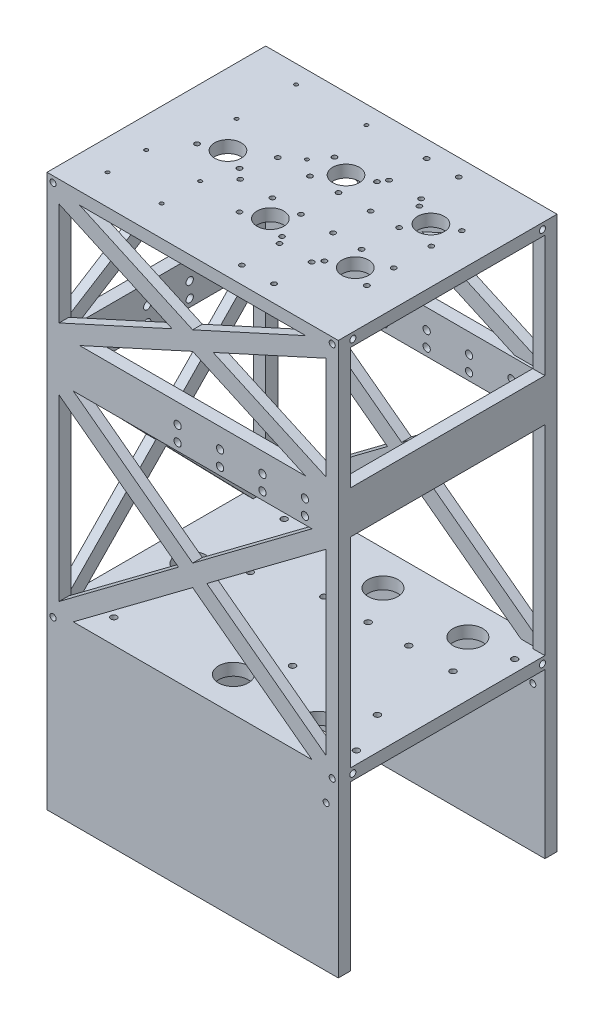
from build123d import *

# Parameters (mm, degrees)
SKETCH1_W                = 240.15
SKETCH1_H                = 180.3
BOSS_EXTRUDE1_DEPTH      = 145
SKETCH2_R                = 12.25
CUT_EXTRUDE1_DEPTH       = 120
SKETCH3_W                = 160.42
SKETCH3_H                = 135.06
CUT_EXTRUDE3_DEPTH       = 220
SKETCH9_W                = 240.15
SKETCH9_H                = 180.3
BOSS_EXTRUDE3_DEPTH      = 310.134
SKETCH14_R               = 11
SKETCH14_R_2             = 2
SKETCH14_R_3             = 1.5
CUT_EXTRUDE6_DEPTH       = 11
SKETCH15_W               = 220.15
SKETCH15_H               = 100.24
SKETCH15_H_2             = 164.844
CUT_EXTRUDE7_DEPTH       = 505.056597597
SKETCH16_W               = 160.3
SKETCH16_H               = 100.24
SKETCH16_H_2             = 164.842
CUT_EXTRUDE8_DEPTH       = 523.442344145
CUT_EXTRUDE9_REACH       = 378.161
SKETCH17_W               = 220.15
SKETCH17_H               = 160.3
SKETCH18_R               = 3
CUT_EXTRUDE10_DEPTH      = 249
SKETCH19_R               = 3
CUT_EXTRUDE11_DEPTH      = 104
SKETCH21_R               = 2.5
CUT_EXTRUDE12_DEPTH      = 8
SKETCH22_R               = 2.5
CUT_EXTRUDE13_DEPTH      = 8
CUT_EXTRUDE14_START      = -8
SKETCH23_R               = 2.5
CUT_EXTRUDE14_DEPTH      = 8
CUT_EXTRUDE15_START      = -8
SKETCH24_R               = 2.5
CUT_EXTRUDE15_DEPTH      = 8
BOSS_EXTRUDE4_DEPTH      = 8
BOSS_EXTRUDE5_DEPTH      = 8
BOSS_EXTRUDE6_DEPTH      = 8
BOSS_EXTRUDE7_DEPTH      = 8
BOSS_EXTRUDE8_DEPTH      = 8
BOSS_EXTRUDE9_DEPTH      = 8
CUT_EXTRUDE16_REACH      = 346.569
SKETCH32_R               = 2.5
CUT_EXTRUDE17_DEPTH      = 501.587148438
CUT_EXTRUDE17_DEPTH_BACK = 501.587148438
SKETCH33_R               = 2.5
CUT_EXTRUDE18_DEPTH      = 514.491947801
CUT_EXTRUDE18_DEPTH_BACK = 514.491947801
SKETCH34_R               = 2.5
SKETCH35_R               = 2.5
CUT_EXTRUDE19_DEPTH      = 10
SKETCH37_R               = 1.5
CUT_EXTRUDE20_DEPTH      = 10


with BuildPart() as part:
    # Sketch1 → Boss-Extrude1 (new body)
    with BuildSketch(Plane(origin=(0, 0, 0), x_dir=(1, 0, 0), z_dir=(0, 1, 0))):
        Rectangle(SKETCH1_W, SKETCH1_H)
    extrude(amount=BOSS_EXTRUDE1_DEPTH)

    # Sketch2 → Cut-Extrude1 (cut)
    with BuildSketch(Plane(origin=(0, 145, 0), x_dir=(1, 0, 0), z_dir=(0, 1, 0))):
        with Locations((75.105, -61.65)):
            Circle(SKETCH2_R)
        with Locations((5.105, -61.65)):
            Circle(SKETCH2_R)
        with Locations((75.105, 61.65)):
            Circle(SKETCH2_R)
        with Locations((5.105, 61.65)):
            Circle(SKETCH2_R)
        with Locations((-91.515, 0)):
            Circle(SKETCH2_R)
    extrude(amount=-CUT_EXTRUDE1_DEPTH, mode=Mode.SUBTRACT)

    # Sketch3 → Cut-Extrude3 (cut)
    with BuildSketch(Plane(origin=(120.075, 0, 0), x_dir=(0, 0, -1), z_dir=(1, 0, 0))):
        with Locations((0, 67.53)):
            Rectangle(SKETCH3_W, SKETCH3_H)
    extrude(amount=-CUT_EXTRUDE3_DEPTH, mode=Mode.SUBTRACT)

    # Sketch9 → Boss-Extrude3 (add)
    with BuildSketch(Plane(origin=(0, 145, 0), x_dir=(1, 0, 0), z_dir=(0, 1, 0))):
        Rectangle(SKETCH9_W, SKETCH9_H)
    extrude(amount=BOSS_EXTRUDE3_DEPTH)

    # Sketch14 → Cut-Extrude6 (cut)
    with BuildSketch(Plane(origin=(0, 455.134, 0), x_dir=(1, 0, 0), z_dir=(0, 1, 0))):
        with Locations((5.105, -31.17)):
            Circle(SKETCH14_R)
        with Locations((75.105, 31.17)):
            Circle(SKETCH14_R)
        with Locations((-61.035, 0)):
            Circle(SKETCH14_R)
        with Locations((75.105, -31.17)):
            Circle(SKETCH14_R)
        with Locations((92.605, -39.14)):
            Circle(SKETCH14_R_2)
        with Locations((57.605, -39.14)):
            Circle(SKETCH14_R_2)
        with Locations((5.105, 31.17)):
            Circle(SKETCH14_R)
        with Locations((92.605, 39.14)):
            Circle(SKETCH14_R_2)
        with Locations((57.605, 39.14)):
            Circle(SKETCH14_R_2)
        with Locations((22.605, -39.14)):
            Circle(SKETCH14_R_2)
        with Locations((-12.395, -39.14)):
            Circle(SKETCH14_R_2)
        with Locations((22.605, 39.14)):
            Circle(SKETCH14_R_2)
        with Locations((-12.395, 39.14)):
            Circle(SKETCH14_R_2)
        with Locations((-43.535, -7.97)):
            Circle(SKETCH14_R_2)
        with Locations((-78.535, -7.97)):
            Circle(SKETCH14_R_2)
        with Locations((-35.422134016, 15.5)):
            Circle(SKETCH14_R_2)
        with Locations((-8.922134016, 15.5)):
            Circle(SKETCH14_R_2)
        with Locations((-8.922134016, -15.5)):
            Circle(SKETCH14_R_2)
        with Locations((-35.422134016, -15.5)):
            Circle(SKETCH14_R_2)
        with Locations((14.577865984, 15.5)):
            Circle(SKETCH14_R_2)
        with Locations((41.077865984, 15.5)):
            Circle(SKETCH14_R_2)
        with Locations((41.077865984, -15.5)):
            Circle(SKETCH14_R_2)
        with Locations((14.577865984, -15.5)):
            Circle(SKETCH14_R_2)
        with Locations((64.577865984, 15.5)):
            Circle(SKETCH14_R_2)
        with Locations((91.077865984, 15.5)):
            Circle(SKETCH14_R_2)
        with Locations((91.077865984, -15.5)):
            Circle(SKETCH14_R_2)
        with Locations((64.577865984, -15.5)):
            Circle(SKETCH14_R_2)
        with Locations((53.075, -45.15)):
            Circle(SKETCH14_R_2)
        with Locations((26.575, -45.15)):
            Circle(SKETCH14_R_2)
        with Locations((26.575, -76.15)):
            Circle(SKETCH14_R_2)
        with Locations((53.075, -76.15)):
            Circle(SKETCH14_R_2)
        with Locations((53.075, 76.15)):
            Circle(SKETCH14_R_2)
        with Locations((26.575, 76.15)):
            Circle(SKETCH14_R_2)
        with Locations((26.575, 45.15)):
            Circle(SKETCH14_R_2)
        with Locations((53.075, 45.15)):
            Circle(SKETCH14_R_2)
        with Locations((-80.075, 75.15)):
            Circle(SKETCH14_R_3)
        with Locations((-22.075, 75.15)):
            Circle(SKETCH14_R_3)
        with Locations((-22.075, 26.15)):
            Circle(SKETCH14_R_3)
        with Locations((-80.075, 26.15)):
            Circle(SKETCH14_R_3)
    extrude(amount=-CUT_EXTRUDE6_DEPTH, mode=Mode.SUBTRACT)

    # Sketch15 → Cut-Extrude7 (cut, through all)
    with BuildSketch(Plane(origin=(0, 0, -90.15), x_dir=(-1, 0, 0), z_dir=(0, 0, -1))):
        with Locations((0, 395.014)):
            Rectangle(SKETCH15_W, SKETCH15_H)
        with Locations((0, 227.422)):
            Rectangle(SKETCH15_W, SKETCH15_H_2)
    extrude(amount=-CUT_EXTRUDE7_DEPTH, mode=Mode.SUBTRACT)

    # Sketch16 → Cut-Extrude8 (cut, through all)
    with BuildSketch(Plane(origin=(120.075, 0, 0), x_dir=(0, 0, -1), z_dir=(1, 0, 0))):
        with Locations((0, 395.014)):
            Rectangle(SKETCH16_W, SKETCH16_H)
        with Locations((0, 227.421)):
            Rectangle(SKETCH16_W, SKETCH16_H_2)
    extrude(amount=-CUT_EXTRUDE8_DEPTH, mode=Mode.SUBTRACT)

    # Sketch17 → Cut-Extrude9 (cut, up to next)
    with BuildSketch(Plane(origin=(0, 344.894, 0), x_dir=(1, 0, 0), z_dir=(0, 1, 0)), mode=Mode.PRIVATE) as cut_extrude9_sk1:
        Rectangle(SKETCH17_W, SKETCH17_H)
    cut_extrude9_tool1 = extrude(cut_extrude9_sk1.sketch, amount=-CUT_EXTRUDE9_REACH, mode=Mode.PRIVATE) & part.part
    add(cut_extrude9_tool1.solids().sort_by_distance((0, 344.894, 0))[0], mode=Mode.SUBTRACT)

    # Sketch18 → Cut-Extrude10 (cut)
    with BuildSketch(Plane.XY.offset(90.15)):
        with Locations((-12.395, 316.144)):
            Circle(SKETCH18_R)
        with Locations((22.605, 316.144)):
            Circle(SKETCH18_R)
        with Locations((57.605, 316.144)):
            Circle(SKETCH18_R)
        with Locations((92.605, 316.144)):
            Circle(SKETCH18_R)
        with Locations((92.605, 328.644)):
            Circle(SKETCH18_R)
        with Locations((57.605, 328.644)):
            Circle(SKETCH18_R)
        with Locations((22.605, 328.644)):
            Circle(SKETCH18_R)
        with Locations((-12.395, 328.644)):
            Circle(SKETCH18_R)
    extrude(amount=-CUT_EXTRUDE10_DEPTH, mode=Mode.SUBTRACT)

    # Sketch19 → Cut-Extrude11 (cut)
    with BuildSketch(Plane.ZY.offset(120.075)):
        with Locations((-17.5, 316.142)):
            Circle(SKETCH19_R)
        with Locations((17.5, 316.142)):
            Circle(SKETCH19_R)
        with Locations((17.5, 328.642)):
            Circle(SKETCH19_R)
        with Locations((-17.5, 328.642)):
            Circle(SKETCH19_R)
    extrude(amount=-CUT_EXTRUDE11_DEPTH, mode=Mode.SUBTRACT)

    # Sketch21 → Cut-Extrude12 (cut)
    with BuildSketch(Plane.XY.offset(90.15)):
        with Locations((-115.075, 450.134)):
            Circle(SKETCH21_R)
        with Locations((115.075, 450.134)):
            Circle(SKETCH21_R)
        with Locations((-115.075, 140)):
            Circle(SKETCH21_R)
        with Locations((115.075, 140)):
            Circle(SKETCH21_R)
    extrude(amount=-CUT_EXTRUDE12_DEPTH, mode=Mode.SUBTRACT)

    # Sketch22 → Cut-Extrude13 (cut)
    with BuildSketch(Plane.ZY.offset(120.075)):
        with Locations((-78.15, 450.134)):
            Circle(SKETCH22_R)
        with Locations((78.15, 450.134)):
            Circle(SKETCH22_R)
        with Locations((-78.15, 140)):
            Circle(SKETCH22_R)
        with Locations((78.15, 140)):
            Circle(SKETCH22_R)
    extrude(amount=-CUT_EXTRUDE13_DEPTH, mode=Mode.SUBTRACT)

    # Sketch23 → Cut-Extrude14 (cut)
    with BuildSketch(Plane(origin=(0, 0, -90.15), x_dir=(-1, 0, 0), z_dir=(0, 0, -1)).offset(CUT_EXTRUDE14_START)):
        with Locations((-115.075, 450.134)):
            Circle(SKETCH23_R)
        with Locations((115.075, 450.134)):
            Circle(SKETCH23_R)
        with Locations((-115.075, 140)):
            Circle(SKETCH23_R)
        with Locations((115.075, 140)):
            Circle(SKETCH23_R)
    extrude(amount=CUT_EXTRUDE14_DEPTH, mode=Mode.SUBTRACT)

    # Sketch24 → Cut-Extrude15 (cut)
    with BuildSketch(Plane(origin=(120.075, 0, 0), x_dir=(0, 0, -1), z_dir=(1, 0, 0)).offset(CUT_EXTRUDE15_START)):
        with Locations((-78.15, 450.134)):
            Circle(SKETCH24_R)
        with Locations((78.15, 450.134)):
            Circle(SKETCH24_R)
        with Locations((-78.15, 140)):
            Circle(SKETCH24_R)
        with Locations((78.15, 140)):
            Circle(SKETCH24_R)
    extrude(amount=CUT_EXTRUDE15_DEPTH, mode=Mode.SUBTRACT)

    # Sketch25 → Boss-Extrude4 (add)
    with BuildSketch(Plane.XY.offset(90.15)):
        Polygon((-110.075, 301.099119749), (-11.67883203, 227.422), (-110.075, 153.744880251), (-110.075, 145), (-98.39616797, 145), (0, 218.677119749), (98.39616797, 145), (110.075, 145), (110.075, 153.744880251), (11.67883203, 227.422), (110.075, 301.099119749), (110.075, 309.844), (98.39616797, 309.844), (0, 236.166880251), (-98.39616797, 309.844), (-110.075, 309.844), align=None)
    extrude(amount=-BOSS_EXTRUDE4_DEPTH)

    # Sketch26 → Boss-Extrude5 (add)
    with BuildSketch(Plane(origin=(0, 0, -90.15), x_dir=(-1, 0, 0), z_dir=(0, 0, -1))):
        Polygon((-110.075, 301.099119749), (-11.67883203, 227.422), (-110.075, 153.744880251), (-110.075, 145), (-98.39616797, 145), (0, 218.677119749), (98.39616797, 145), (110.075, 145), (110.075, 153.744880251), (11.67883203, 227.422), (110.075, 301.099119749), (110.075, 309.844), (98.39616797, 309.844), (0, 236.166880251), (-98.39616797, 309.844), (-110.075, 309.844), align=None)
    extrude(amount=-BOSS_EXTRUDE5_DEPTH)

    # Sketch27 → Boss-Extrude6 (add)
    with BuildSketch(Plane.ZY.offset(120.075)):
        Polygon((-80.15, 301.253178675), (-8.352167885, 227.421), (-80.15, 153.588821325), (-80.15, 145), (-71.797832115, 145), (0, 218.832178675), (71.797832115, 145), (80.15, 145), (80.15, 153.588821325), (8.352167885, 227.421), (80.15, 301.253178675), (80.15, 309.842), (71.797832115, 309.842), (0, 236.009821325), (-71.797832115, 309.842), (-80.15, 309.842), align=None)
    extrude(amount=-BOSS_EXTRUDE6_DEPTH)

    # Sketch29 → Boss-Extrude7 (add)
    with BuildSketch(Plane.ZY.offset(120.075)):
        Polygon((-80.15, 438.071871828), (-11.293487091, 395.014), (-80.15, 351.956128172), (-80.15, 344.894), (-68.856512909, 344.894), (0, 387.951871828), (68.856512909, 344.894), (80.15, 344.894), (80.15, 351.956128172), (11.293487091, 395.014), (80.15, 438.071871828), (80.15, 445.134), (68.856512909, 445.134), (0, 402.076128172), (-68.856512909, 445.134), (-80.15, 445.134), align=None)
    extrude(amount=-BOSS_EXTRUDE7_DEPTH)

    # Sketch30 → Boss-Extrude8 (add)
    with BuildSketch(Plane(origin=(0, 0, -90.15), x_dir=(-1, 0, 0), z_dir=(0, 0, -1))):
        Polygon((-110.075, 437.442526623), (-16.892237271, 395.014), (-110.075, 352.585473377), (-110.075, 344.894), (-93.182762729, 344.894), (0, 387.322526623), (93.182762729, 344.894), (110.075, 344.894), (110.075, 352.585473377), (16.892237271, 395.014), (110.075, 437.442526623), (110.075, 445.134), (93.182762729, 445.134), (0, 402.705473377), (-93.182762729, 445.134), (-110.075, 445.134), align=None)
    extrude(amount=-BOSS_EXTRUDE8_DEPTH)

    # Sketch31 → Boss-Extrude9 (add)
    with BuildSketch(Plane.XY.offset(90.15)):
        Polygon((-110.075, 437.442526623), (-16.892237271, 395.014), (-110.075, 352.585473377), (-110.075, 344.894), (-93.182762729, 344.894), (0, 387.322526623), (93.182762729, 344.894), (110.075, 344.894), (110.075, 352.585473377), (16.892237271, 395.014), (110.075, 437.442526623), (110.075, 445.134), (93.182762729, 445.134), (0, 402.705473377), (-93.182762729, 445.134), (-110.075, 445.134), align=None)
    extrude(amount=-BOSS_EXTRUDE9_DEPTH)

    # Sketch32 → Cut-Extrude16 (cut, up to next)
    with BuildSketch(Plane(origin=(0, 145, 0), x_dir=(1, 0, 0), z_dir=(0, 1, 0)), mode=Mode.PRIVATE) as cut_extrude16_sk1:
        with Locations((93.355, 31.14)):
            Circle(SKETCH32_R)
    cut_extrude16_tool1 = extrude(cut_extrude16_sk1.sketch, amount=-CUT_EXTRUDE16_REACH, mode=Mode.PRIVATE) & part.part
    # Sketch32 → Cut-Extrude16 (cut, up to next)
    with BuildSketch(Plane(origin=(0, 145, 0), x_dir=(1, 0, 0), z_dir=(0, 1, 0)), mode=Mode.PRIVATE) as cut_extrude16_sk2:
        with Locations((56.855, 31.14)):
            Circle(SKETCH32_R)
    cut_extrude16_tool2 = extrude(cut_extrude16_sk2.sketch, amount=-CUT_EXTRUDE16_REACH, mode=Mode.PRIVATE) & part.part
    # Sketch32 → Cut-Extrude16 (cut, up to next)
    with BuildSketch(Plane(origin=(0, 145, 0), x_dir=(1, 0, 0), z_dir=(0, 1, 0)), mode=Mode.PRIVATE) as cut_extrude16_sk3:
        with Locations((23.355, 31.14)):
            Circle(SKETCH32_R)
    cut_extrude16_tool3 = extrude(cut_extrude16_sk3.sketch, amount=-CUT_EXTRUDE16_REACH, mode=Mode.PRIVATE) & part.part
    # Sketch32 → Cut-Extrude16 (cut, up to next)
    with BuildSketch(Plane(origin=(0, 145, 0), x_dir=(1, 0, 0), z_dir=(0, 1, 0)), mode=Mode.PRIVATE) as cut_extrude16_sk4:
        with Locations((-13.145, 31.14)):
            Circle(SKETCH32_R)
    cut_extrude16_tool4 = extrude(cut_extrude16_sk4.sketch, amount=-CUT_EXTRUDE16_REACH, mode=Mode.PRIVATE) & part.part
    # Sketch32 → Cut-Extrude16 (cut, up to next)
    with BuildSketch(Plane(origin=(0, 145, 0), x_dir=(1, 0, 0), z_dir=(0, 1, 0)), mode=Mode.PRIVATE) as cut_extrude16_sk5:
        with Locations((-13.145, -31.14)):
            Circle(SKETCH32_R)
    cut_extrude16_tool5 = extrude(cut_extrude16_sk5.sketch, amount=-CUT_EXTRUDE16_REACH, mode=Mode.PRIVATE) & part.part
    # Sketch32 → Cut-Extrude16 (cut, up to next)
    with BuildSketch(Plane(origin=(0, 145, 0), x_dir=(1, 0, 0), z_dir=(0, 1, 0)), mode=Mode.PRIVATE) as cut_extrude16_sk6:
        with Locations((23.355, -31.14)):
            Circle(SKETCH32_R)
    cut_extrude16_tool6 = extrude(cut_extrude16_sk6.sketch, amount=-CUT_EXTRUDE16_REACH, mode=Mode.PRIVATE) & part.part
    # Sketch32 → Cut-Extrude16 (cut, up to next)
    with BuildSketch(Plane(origin=(0, 145, 0), x_dir=(1, 0, 0), z_dir=(0, 1, 0)), mode=Mode.PRIVATE) as cut_extrude16_sk7:
        with Locations((56.855, -31.14)):
            Circle(SKETCH32_R)
    cut_extrude16_tool7 = extrude(cut_extrude16_sk7.sketch, amount=-CUT_EXTRUDE16_REACH, mode=Mode.PRIVATE) & part.part
    # Sketch32 → Cut-Extrude16 (cut, up to next)
    with BuildSketch(Plane(origin=(0, 145, 0), x_dir=(1, 0, 0), z_dir=(0, 1, 0)), mode=Mode.PRIVATE) as cut_extrude16_sk8:
        with Locations((93.355, -31.14)):
            Circle(SKETCH32_R)
    cut_extrude16_tool8 = extrude(cut_extrude16_sk8.sketch, amount=-CUT_EXTRUDE16_REACH, mode=Mode.PRIVATE) & part.part
    # Sketch32 → Cut-Extrude16 (cut, up to next)
    with BuildSketch(Plane(origin=(0, 145, 0), x_dir=(1, 0, 0), z_dir=(0, 1, 0)), mode=Mode.PRIVATE) as cut_extrude16_sk9:
        with Locations((-61.005, -18.249975342)):
            Circle(SKETCH32_R)
    cut_extrude16_tool9 = extrude(cut_extrude16_sk9.sketch, amount=-CUT_EXTRUDE16_REACH, mode=Mode.PRIVATE) & part.part
    # Sketch32 → Cut-Extrude16 (cut, up to next)
    with BuildSketch(Plane(origin=(0, 145, 0), x_dir=(1, 0, 0), z_dir=(0, 1, 0)), mode=Mode.PRIVATE) as cut_extrude16_sk10:
        with Locations((-61.005, 18.249975342)):
            Circle(SKETCH32_R)
    cut_extrude16_tool10 = extrude(cut_extrude16_sk10.sketch, amount=-CUT_EXTRUDE16_REACH, mode=Mode.PRIVATE) & part.part
    add(cut_extrude16_tool1.solids().sort_by_distance((93.355, 145, -31.14))[0], mode=Mode.SUBTRACT)
    add(cut_extrude16_tool2.solids().sort_by_distance((56.855, 145, -31.14))[0], mode=Mode.SUBTRACT)
    add(cut_extrude16_tool3.solids().sort_by_distance((23.355, 145, -31.14))[0], mode=Mode.SUBTRACT)
    add(cut_extrude16_tool4.solids().sort_by_distance((-13.145, 145, -31.14))[0], mode=Mode.SUBTRACT)
    add(cut_extrude16_tool5.solids().sort_by_distance((-13.145, 145, 31.14))[0], mode=Mode.SUBTRACT)
    add(cut_extrude16_tool6.solids().sort_by_distance((23.355, 145, 31.14))[0], mode=Mode.SUBTRACT)
    add(cut_extrude16_tool7.solids().sort_by_distance((56.855, 145, 31.14))[0], mode=Mode.SUBTRACT)
    add(cut_extrude16_tool8.solids().sort_by_distance((93.355, 145, 31.14))[0], mode=Mode.SUBTRACT)
    add(cut_extrude16_tool9.solids().sort_by_distance((-61.005, 145, 18.249975))[0], mode=Mode.SUBTRACT)
    add(cut_extrude16_tool10.solids().sort_by_distance((-61.005, 145, -18.249975))[0], mode=Mode.SUBTRACT)

    # Sketch33 → Cut-Extrude17 (cut, two sides: drawn at the far end of the back side and taken through both)
    with BuildSketch(Plane(origin=(0, 0, 80.21), x_dir=(-1, 0, 0), z_dir=(0, 0, -1)).offset(-CUT_EXTRUDE17_DEPTH_BACK)):
        with Locations((-110.075, 120.06)):
            Circle(SKETCH33_R)
    extrude(amount=CUT_EXTRUDE17_DEPTH + CUT_EXTRUDE17_DEPTH_BACK, mode=Mode.SUBTRACT)

    # Sketch34 → Cut-Extrude18 (cut, two sides: drawn at the far end of the back side and taken through both)
    with BuildSketch(Plane(origin=(-99.925, 0, 0), x_dir=(0, 0, -1), z_dir=(1, 0, 0)).offset(-CUT_EXTRUDE18_DEPTH_BACK)):
        with Locations((-70.21, 120.06)):
            Circle(SKETCH34_R)
        with Locations((70.21, 120.06)):
            Circle(SKETCH34_R)
    extrude(amount=CUT_EXTRUDE18_DEPTH + CUT_EXTRUDE18_DEPTH_BACK, mode=Mode.SUBTRACT)

    # Sketch35 → Cut-Extrude19 (cut)
    with BuildSketch(Plane.XZ.offset(-135.06)):
        with Locations((110.075, 65.21)):
            Circle(SKETCH35_R)
        with Locations((110.075, -65.21)):
            Circle(SKETCH35_R)
        with Locations((-84.925, -70.21)):
            Circle(SKETCH35_R)
        with Locations((-84.925, 70.21)):
            Circle(SKETCH35_R)
    extrude(amount=-CUT_EXTRUDE19_DEPTH, mode=Mode.SUBTRACT)

    # Sketch37 → Cut-Extrude20 (cut)
    with BuildSketch(Plane(origin=(0, 455.134, 0), x_dir=(1, 0, 0), z_dir=(0, 1, 0))):
        with Locations((-95.075, -33.35)):
            Circle(SKETCH37_R)
        with Locations((-50.575, -33.35)):
            Circle(SKETCH37_R)
        with Locations((-95.075, -65.15)):
            Circle(SKETCH37_R)
        with Locations((-50.575, -65.15)):
            Circle(SKETCH37_R)
    extrude(amount=-CUT_EXTRUDE20_DEPTH, mode=Mode.SUBTRACT)


solid = part.part
